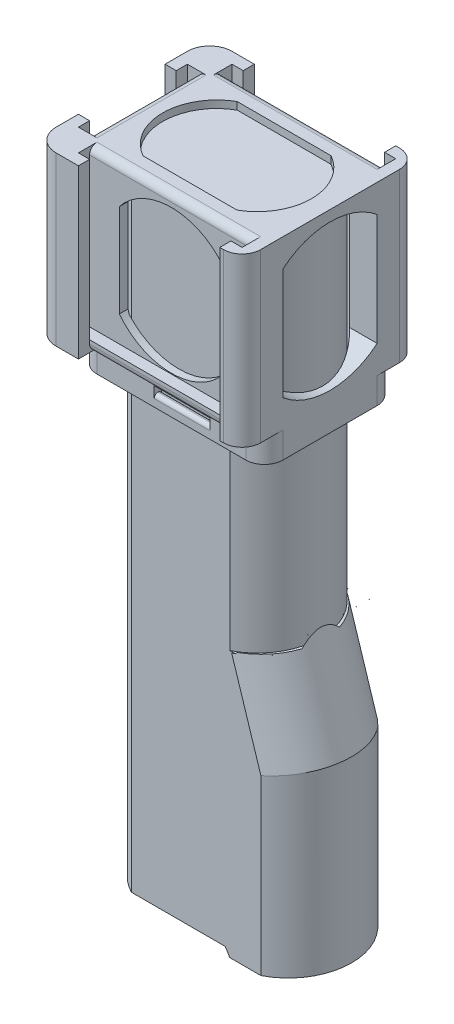
from build123d import *

# Parameters (mm, degrees)
BOSS_EXTRUDE1_DEPTH      = 30.3
CUT_EXTRUDE1_DEPTH       = 181.717957049
CUT_EXTRUDE7_DEPTH       = 27.29
CUT_EXTRUDE10_DEPTH      = 96
CUT_EXTRUDE11_DEPTH      = 48
SKETCH9_W                = 2
SKETCH9_H                = 7.4
BOSS_EXTRUDE2_DEPTH      = 1.5
FILLET8_R                = 1
CUT_EXTRUDE15_DEPTH      = 2.6
CUT_EXTRUDE15_DEPTH_BACK = 2.6
SKETCH10_W               = 29
SKETCH10_H               = 15.5
SKETCH11_W               = 3.45
SKETCH11_H               = 8
BOSS_EXTRUDE3_DEPTH      = 1.3
FILLET9_R                = 7
CUT_EXTRUDE18_DEPTH      = 2.5
CUT_EXTRUDE23_START      = -2.5
CUT_EXTRUDE23_DEPTH      = 2.5
SKETCH18_W               = 4.5
SKETCH18_H               = 15
SKETCH18_W_2             = 3.45
SKETCH18_H_2             = 8
CUT_EXTRUDE24_DEPTH      = 1
THICKEN1_DEPTH           = 172.5
THICKEN1_START           = 71.5
THICKEN1_2_DEPTH         = 101
THICKEN1_START_2         = 170.5
THICKEN1_3_DEPTH         = 2
THICKEN1_4_DEPTH         = 71.5
THICKEN1_START_3         = 74
THICKEN1_5_DEPTH         = 96.5
THICKEN1_START_4         = -3
THICKEN1_6_DEPTH         = 37
CUT_EXTRUDE25_DEPTH      = 185.724309905
CUT_EXTRUDE25_DEPTH_BACK = 2
CUT_EXTRUDE26_START      = -35.3
SKETCH20_W               = 86.063057596
SKETCH20_H               = 120.5
CUT_EXTRUDE26_DEPTH      = 35.3
BOSS_EXTRUDE5_START      = -52
BOSS_EXTRUDE5_DEPTH      = 52
BOSS_EXTRUDE6_DEPTH      = 45
FILLET12_R               = 5
SKETCH23_W               = 15
SKETCH23_H               = 2
CUT_EXTRUDE27_DEPTH      = 186.210231899
FILLET16_R               = 1
SKETCH24_W               = 44
SKETCH24_H               = 3
SKETCH24_W_2             = 3
SKETCH24_H_2             = 29.3
BOSS_EXTRUDE7_DEPTH      = 3
SKETCH25_W               = 25.3
SKETCH25_H               = 30
CUT_EXTRUDE28_DEPTH      = 50
SKETCH26_W               = 28
SKETCH26_H               = 25
CUT_EXTRUDE29_DEPTH      = 50
FILLET17_R               = 2
FILLET18_R               = 5


with BuildPart() as part:
    # Sketch1 → Boss-Extrude1 (new body)
    with BuildSketch(Plane.XY):
        Polygon((34.45, 2), (35.7, 0), (53.3, 0), (53.3, 48), (45, 74), (45, 170), (0, 170), (0, 2), align=None)
    extrude(amount=BOSS_EXTRUDE1_DEPTH)

    # Sketch2 → Cut-Extrude1 (cut, through all)
    with BuildSketch(Plane(origin=(0, 170, 0), x_dir=(1, 0, 0), z_dir=(0, 1, 0))):
        with BuildLine():
            Line((0, -30.3), (9.25, -30.3))
            ThreePointArc((9.25, -30.3), (2.495291793, -24.025316905), (0, -15.150000022))
            Line((0, -15.150000022), (0, -30.3))
        make_face()
        with BuildLine():
            ThreePointArc((0, -15.150000022), (2.495291781, -6.274683113), (9.25, 0))
            Line((9.25, 0), (0, 0))
            Line((0, 0), (0, -15.150000022))
        make_face()
    extrude(amount=-CUT_EXTRUDE1_DEPTH, mode=Mode.SUBTRACT)

    # Sketch7 → Cut-Extrude7 (cut)
    with BuildSketch(Plane(origin=(-8.97657775, 28.11940018, 0), x_dir=(0, 0, -1), z_dir=(0.30411092373144827, -0.9526366285563479, 0))):
        with BuildLine():
            Line((-15.15, 65.372856641), (-30.3, 65.372856641))
            Line((-30.3, 65.372856641), (-30.3, 56.120928382))
            ThreePointArc((-30.3, 56.120928382), (-24.02581935, 62.876979624), (-15.15, 65.372856641))
        make_face()
        with BuildLine():
            Line((0, 65.372856641), (-15.15, 65.372856641))
            ThreePointArc((-15.15, 65.372856641), (-6.27418065, 62.876979624), (0, 56.120928382))
            Line((0, 56.120928382), (0, 65.372856641))
        make_face()
    extrude(amount=-CUT_EXTRUDE7_DEPTH, mode=Mode.SUBTRACT)

    # Sketch6 → Cut-Extrude10 (cut)
    with BuildSketch(Plane(origin=(0, 170, 0), x_dir=(1, 0, 0), z_dir=(0, 1, 0))):
        with BuildLine():
            Line((45, -15.15), (45, 0))
            Line((45, 0), (35.74807174, 0))
            ThreePointArc((35.74807174, 0), (42.504122982, -6.27418065), (45, -15.15))
        make_face()
        with BuildLine():
            Line((45, -30.3), (45, -15.15))
            ThreePointArc((45, -15.15), (42.504122982, -24.02581935), (35.74807174, -30.3))
            Line((35.74807174, -30.3), (45, -30.3))
        make_face()
    extrude(amount=-CUT_EXTRUDE10_DEPTH, mode=Mode.SUBTRACT)

    # Sketch4 → Cut-Extrude11 (cut)
    with BuildSketch(Plane.XZ):
        with BuildLine():
            Line((53.3, 15.15), (53.3, 30.3))
            Line((53.3, 30.3), (44.04807174, 30.3))
            ThreePointArc((44.04807174, 30.3), (50.804122982, 24.02581935), (53.3, 15.15))
        make_face()
        with BuildLine():
            Line((53.3, 0), (53.3, 15.15))
            ThreePointArc((53.3, 15.15), (50.804122982, 6.27418065), (44.04807174, 0))
            Line((44.04807174, 0), (53.3, 0))
        make_face()
    extrude(amount=-CUT_EXTRUDE11_DEPTH, mode=Mode.SUBTRACT)

    # Sketch9 → Boss-Extrude2 (add)
    with BuildSketch(Plane.XZ.offset(-2)):
        with Locations((3, 15.15)):
            Rectangle(SKETCH9_W, SKETCH9_H)
    extrude(amount=BOSS_EXTRUDE2_DEPTH)

    # Fillet8
    fillet8_edges = [part.edges().sort_by_distance(p)[0] for p in [
        (4, 1.25, 11.45),
        (2, 1.25, 11.45),
        (4, 1.25, 18.85),
        (2, 1.25, 18.85),
    ]]
    fillet(fillet8_edges, radius=FILLET8_R - 0.0001)  # a hair under: the kernel refuses the full size

    # Sketch10 → Cut-Extrude15 (cut, two sides: drawn at the far end of the back side and taken through both)
    with BuildSketch(Plane.XZ.offset(-2).offset(-CUT_EXTRUDE15_DEPTH_BACK)):
        with Locations((21, 15.15)):
            Rectangle(SKETCH10_W, SKETCH10_H)
    extrude(amount=CUT_EXTRUDE15_DEPTH + CUT_EXTRUDE15_DEPTH_BACK, mode=Mode.SUBTRACT)

    # Sketch11 → Boss-Extrude3 (add)
    with BuildSketch(Plane.XZ):
        with Locations((43.575, 15.15)):
            Rectangle(SKETCH11_W, SKETCH11_H)
    extrude(amount=BOSS_EXTRUDE3_DEPTH)

    # Fillet9
    # the kernel refuses this fillet: 7 mm, written as the material it takes off along each edge
    with BuildSketch(Plane(origin=(55.458124827, -1.3, 11.15), x_dir=(0, 1, 0), z_dir=(-1, 0, 0)), Plane(origin=(31.691875173, -1.3, 19.15), x_dir=(0, 1, 0), z_dir=(1, 0, 0))) as fillet9_piece_1:
        with BuildLine():
            CenterArc((7, -4.063249931), FILLET9_R, 144.516796045, 35.483203955)
            Line((0, -4.063249931), (-0.14, -4.063249931))
            Line((-0.14, -4.063249931), (-0.14, 0))
            Line((-0.14, 0), (0, 0.14))
            ThreePointArc((0, 0.14), (0.65, 0.14), (1.186, 0.081264999))
            Line((1.186, 0.081264999), (1.3, 0))
        make_face()
    extrude(amount=23.766249654, mode=Mode.SUBTRACT)

    # Sketch13 → Cut-Extrude18 (cut)
    with BuildSketch(Plane(origin=(0, 74, 0), x_dir=(1, 0, 0), z_dir=(0, 1, 0))):
        with BuildLine():
            Line((35.74807174, -30.3), (45, -30.3))
            Line((45, -30.3), (45, -15.15))
            ThreePointArc((45, -15.15), (42.504122982, -24.02581935), (35.74807174, -30.3))
        make_face()
    extrude(amount=-CUT_EXTRUDE18_DEPTH, mode=Mode.SUBTRACT)

    # Cut-Extrude23: read off the stored shape, not the designer's step
    # Cut-Extrude23 outline → Cut-Extrude23 (cut)
    with BuildSketch(Plane(origin=(0, 74, 0), x_dir=(1, 0, 0), z_dir=(0, 1, 0)).offset(CUT_EXTRUDE23_START)):
        with BuildLine():
            ThreePointArc((44.999624541, -15.036915931), (44.999829684, -15.061319249), (45, -15.085722835))
            Line((45, -15.085722835), (45, 0))
            Line((45, 0), (35.74807174, 0))
            ThreePointArc((35.74807174, 0), (42.474573722, -6.225973939), (44.999624541, -15.036915931))
        make_face()
    extrude(amount=CUT_EXTRUDE23_DEPTH, mode=Mode.SUBTRACT)

    # Sketch18 → Cut-Extrude24 (cut)
    with BuildSketch(Plane.XZ):
        with Locations((43.575, 15.15)):
            Rectangle(SKETCH18_W, SKETCH18_H)
        with Locations((43.575, 15.15)):
            Rectangle(SKETCH18_W_2, SKETCH18_H_2, mode=Mode.SUBTRACT)
    extrude(amount=-CUT_EXTRUDE24_DEPTH, mode=Mode.SUBTRACT)


with BuildPart() as body_2:
    # Thicken1: read off the stored shape, not the designer's step
    # Thicken1 outline → Thicken1 (new body)
    with BuildSketch(Plane(origin=(0, 0, 0), x_dir=(1, 0, 0), z_dir=(0, 1, 0))):
        with BuildLine():
            ThreePointArc((36.330526299, -32.8), (38.041656858, -31.882681439), (39.653252972, -30.8))
            Line((39.653252972, -30.8), (9.130023259, -30.8))
            ThreePointArc((9.130023259, -30.8), (-0.5, -15.15), (9.130023259, 0.5))
            Line((9.130023259, 0.5), (39.653252972, 0.5))
            ThreePointArc((39.653252972, 0.5), (38.041656858, 1.582681439), (36.330526299, 2.5))
            Line((36.330526299, 2.5), (8.667307952, 2.5))
            ThreePointArc((8.667307952, 2.5), (-2.5, -15.15), (8.667307952, -32.8))
            Line((8.667307952, -32.8), (36.330526299, -32.8))
        make_face()
    extrude(amount=THICKEN1_DEPTH)

    # Thicken1 2 outline → Thicken1 2 (add)
    with BuildSketch(Plane(origin=(0, 0, 0), x_dir=(1, 0, 0), z_dir=(0, 1, 0)).offset(THICKEN1_START)):
        with BuildLine():
            ThreePointArc((39.653252972, -30.8), (45.428448249, -23.903484148), (47.5, -15.15))
            Line((47.5, -15.15), (45.5, -15.15))
            ThreePointArc((45.5, -15.15), (42.899046111, -24.338279611), (35.867999747, -30.8))
            Line((35.867999747, -30.8), (39.653252972, -30.8))
        make_face()
        with BuildLine():
            Line((45.499613517, -15.033595788), (47.499569423, -15.020315216))
            ThreePointArc((47.499569423, -15.020315216), (45.399289044, -6.338599235), (39.653252972, 0.5))
            Line((39.653252972, 0.5), (35.867999747, 0.5))
            ThreePointArc((35.867999747, 0.5), (42.868457256, -5.912204192), (45.499613517, -15.033595788))
        make_face()
    extrude(amount=THICKEN1_2_DEPTH)

    # Thicken1 3 outline → Thicken1 3 (add)
    with BuildSketch(Plane(origin=(0, 0, 0), x_dir=(1, 0, 0), z_dir=(0, 1, 0)).offset(THICKEN1_START_2)):
        with BuildLine():
            Line((45.5, -15.15), (47.5, -15.15))
            ThreePointArc((47.5, -15.15), (47.499892356, -15.085157251), (47.499569423, -15.020315216))
            Line((47.499569423, -15.020315216), (45.499613517, -15.033595788))
            ThreePointArc((45.499613517, -15.033595788), (42.868457256, -5.912204192), (35.867999747, 0.5))
            Line((35.867999747, 0.5), (9.130023259, 0.5))
            ThreePointArc((9.130023259, 0.5), (-0.5, -15.15), (9.130023259, -30.8))
            Line((9.130023259, -30.8), (35.867999747, -30.8))
            ThreePointArc((35.867999747, -30.8), (42.899046111, -24.338279611), (45.5, -15.15))
        make_face()
    extrude(amount=THICKEN1_3_DEPTH)

    # Thicken1 4 outline → Thicken1 4 (add)
    with BuildSketch(Plane(origin=(0, 0, 0), x_dir=(1, 0, 0), z_dir=(0, 1, 0))):
        with BuildLine():
            Line((44.04807174, -30.8), (39.653252972, -30.8))
            ThreePointArc((39.653252972, -30.8), (38.041656858, -31.882681439), (36.330526299, -32.8))
            Line((36.330526299, -32.8), (44.04807174, -32.8))
            Line((44.04807174, -32.8), (44.04807174, -30.8))
        make_face()
        with BuildLine():
            ThreePointArc((36.330526299, 2.5), (38.041656858, 1.582681439), (39.653252972, 0.5))
            Line((39.653252972, 0.5), (44.04807174, 0.5))
            Line((44.04807174, 0.5), (44.04807174, 2.5))
            Line((44.04807174, 2.5), (36.330526299, 2.5))
        make_face()
    extrude(amount=THICKEN1_4_DEPTH)

    # Thicken1 5 outline → Thicken1 5 (add)
    with BuildSketch(Plane(origin=(0, 0, 0), x_dir=(1, 0, 0), z_dir=(0, 1, 0)).offset(THICKEN1_START_3)):
        with BuildLine():
            Line((45.5, -15.15), (47.5, -15.15))
            ThreePointArc((47.5, -15.15), (47.499892356, -15.085157251), (47.499569423, -15.020315216))
            Line((47.499569423, -15.020315216), (45.499613517, -15.033595788))
            ThreePointArc((45.499613517, -15.033595788), (45.499903379, -15.091797573), (45.5, -15.15))
        make_face()
    extrude(amount=THICKEN1_5_DEPTH)

    # Thicken1 6 outline → Thicken1 6 (cut)
    with BuildSketch(Plane.XY.offset(THICKEN1_START_4)):
        Polygon((44.04807174, 71.5), (37.177464286, 71.5), (36.187087147, 71.183841144), (44.04807174, 46.559070127), align=None)
        Polygon((-4, 0), (35.7, 0), (34.45, 2), (-4, 2), align=None)
    extrude(amount=THICKEN1_6_DEPTH, mode=Mode.SUBTRACT)

    # Sketch19 → Cut-Extrude25 (cut, two sides: drawn at the far end of the back side and taken through both)
    with BuildSketch(Plane(origin=(0, 172.5, 0), x_dir=(1, 0, 0), z_dir=(0, 1, 0)).offset(-CUT_EXTRUDE25_DEPTH_BACK)):
        with BuildLine():
            Line((9.880011526, -27.8), (35.118314487, -27.8))
            ThreePointArc((35.118314487, -27.8), (42.5, -15.15), (35.118314487, -2.5))
            Line((35.118314487, -2.5), (9.880011526, -2.5))
            ThreePointArc((9.880011526, -2.5), (2.5, -15.15), (9.880011526, -27.8))
        make_face()
    extrude(amount=CUT_EXTRUDE25_DEPTH + CUT_EXTRUDE25_DEPTH_BACK, mode=Mode.SUBTRACT)

    # Sketch20 → Cut-Extrude26 (cut)
    with BuildSketch(Plane(origin=(0, 0, -2.5), x_dir=(-1, 0, 0), z_dir=(0, 0, -1)).offset(CUT_EXTRUDE26_START)):
        with Locations((-40.531528798, 60.25)):
            Rectangle(SKETCH20_W, SKETCH20_H)
    extrude(amount=CUT_EXTRUDE26_DEPTH, mode=Mode.SUBTRACT)

    # Sketch21 → Boss-Extrude5 (add)
    with BuildSketch(Plane(origin=(0, 172.5, 0), x_dir=(1, 0, 0), z_dir=(0, 1, 0)).offset(BOSS_EXTRUDE5_START)):
        with BuildLine():
            Line((8.667307952, 2.5), (-2.5, 2.5))
            Line((-2.5, 2.5), (-2.5, -15.149999996))
            ThreePointArc((-2.5, -15.149999996), (0.526276233, -4.706924938), (8.667307952, 2.5))
        make_face()
        with BuildLine():
            ThreePointArc((8.667307952, -32.8), (0.52627623, -25.593075059), (-2.5, -15.149999996))
            Line((-2.5, -15.149999996), (-2.5, -32.8))
            Line((-2.5, -32.8), (8.667307952, -32.8))
        make_face()
        with BuildLine():
            Line((47.5, 2.5), (36.330526299, 2.5))
            ThreePointArc((36.330526299, 2.5), (44.473059998, -4.706345913), (47.5, -15.15))
            Line((47.5, -15.15), (47.5, 2.5))
        make_face()
        with BuildLine():
            Line((47.5, -32.8), (47.5, -15.15))
            ThreePointArc((47.5, -15.15), (44.473059998, -25.593654087), (36.330526299, -32.8))
            Line((36.330526299, -32.8), (47.5, -32.8))
        make_face()
    extrude(amount=BOSS_EXTRUDE5_DEPTH)

    # Sketch22 → Boss-Extrude6 (add)
    with BuildSketch(Plane(origin=(0, 172.5, 0), x_dir=(1, 0, 0), z_dir=(0, 1, 0))):
        Polygon((0.5, -32.8), (-2.5, -32.8), (-2.5, -38.8), (3.5, -38.8), (3.5, -35.8), (0.5, -35.8), align=None)
        Polygon((47.5, -32.8), (44.5, -32.8), (44.5, -35.8), (41.5, -35.8), (41.5, -38.8), (47.5, -38.8), align=None)
        Polygon((-8.5, -32.8), (-2.5, -32.8), (-2.5, -29.8), (-5.5, -29.8), (-5.5, -26.8), (-8.5, -26.8), align=None)
        Polygon((-5.5, -0.5), (-2.5, -0.5), (-2.5, 2.5), (-8.5, 2.5), (-8.5, -3.5), (-5.5, -3.5), align=None)
        Polygon((-2.5, 8.5), (-2.5, 2.5), (0.5, 2.5), (0.5, 5.5), (3.5, 5.5), (3.5, 8.5), align=None)
        Polygon((44.5, 5.5), (44.5, 2.5), (47.5, 2.5), (47.5, 8.5), (41.5, 8.5), (41.5, 5.5), align=None)
        with BuildLine():
            Line((-2.5, -32.8), (-8.5, -32.8))
            ThreePointArc((-8.5, -32.8), (-6.742640687, -37.042640687), (-2.5, -38.8))
            Line((-2.5, -38.8), (-2.5, -32.8))
        make_face()
        with BuildLine():
            ThreePointArc((-8.5, 2.5), (-6.742640687, 6.742640687), (-2.5, 8.5))
            Line((-2.5, 8.5), (-2.5, 2.5))
            Line((-2.5, 2.5), (-8.5, 2.5))
        make_face()
    extrude(amount=-BOSS_EXTRUDE6_DEPTH)

    # Fillet12
    fillet12_edges = [body_2.edges().sort_by_distance(p)[0] for p in [
        (47.5, 150, 38.8),
        (47.5, 150, -8.5),
    ]]
    fillet(fillet12_edges, radius=FILLET12_R)

    # Sketch23 → Cut-Extrude27 (cut, through all)
    with BuildSketch(Plane.XY.offset(32.8)):
        with Locations((25.38, 124.5)):
            Rectangle(SKETCH23_W, SKETCH23_H)
    extrude(amount=-CUT_EXTRUDE27_DEPTH, mode=Mode.SUBTRACT)

    # Fillet16
    fillet16_edges = [body_2.edges().sort_by_distance(p)[0] for p in [
        (25.38, 123.5, -0.5),
        (25.38, 123.5, -2.5),
        (25.38, 123.5, 30.8),
        (25.38, 123.5, 32.8),
    ]]
    fillet(fillet16_edges, radius=FILLET16_R - 0.0001)  # a hair under: the kernel refuses the full size

    # Sketch24 → Boss-Extrude7 (add)
    with BuildSketch(Plane.XZ.offset(-127.5)):
        with Locations((22.5, 34.3)):
            Rectangle(SKETCH24_W, SKETCH24_H)
        with Locations((-4, 15.15)):
            Rectangle(SKETCH24_W_2, SKETCH24_H_2)
        with Locations((22.5, -4)):
            Rectangle(SKETCH24_W, SKETCH24_H)
    extrude(amount=-BOSS_EXTRUDE7_DEPTH)

    # Sketch25 → Cut-Extrude28 (cut)
    with BuildSketch(Plane(origin=(47.5, 0, 0), x_dir=(0, 0, -1), z_dir=(1, 0, 0))):
        with Locations((-15.15, 150)):
            Rectangle(SKETCH25_W, SKETCH25_H)
        with BuildLine():
            ThreePointArc((-27.8, 165), (-15.15, 169.614933189), (-2.5, 165))
            Line((-2.5, 165), (-27.8, 165))
        make_face()
        with BuildLine():
            Line((-27.8, 135), (-2.5, 135))
            ThreePointArc((-2.5, 135), (-15.15, 130.385066811), (-27.8, 135))
        make_face()
    extrude(amount=-CUT_EXTRUDE28_DEPTH, mode=Mode.SUBTRACT)

    # Sketch26 → Cut-Extrude29 (cut)
    with BuildSketch(Plane.XY.offset(32.8)):
        with Locations((22.5, 150)):
            Rectangle(SKETCH26_W, SKETCH26_H)
        with BuildLine():
            ThreePointArc((8.5, 162.5), (22.5, 169.311701585), (36.5, 162.5))
            Line((36.5, 162.5), (8.5, 162.5))
        make_face()
        with BuildLine():
            Line((8.5, 137.5), (36.5, 137.5))
            ThreePointArc((36.5, 137.5), (22.5, 130.688298415), (8.5, 137.5))
        make_face()
    extrude(amount=-CUT_EXTRUDE29_DEPTH, mode=Mode.SUBTRACT)

    # Fillet17
    fillet17_edges = [body_2.edges().sort_by_distance(p)[0] for p in [
        (22.5, 172.5, 32.8),
        (22.5, 172.5, -2.5),
        (-2.5, 172.5, 15.15),
        (22.5, 127.5, 35.8),
        (-5.5, 127.5, 15.15),
        (22.5, 127.5, -5.5),
    ]]
    fillet(fillet17_edges, radius=FILLET17_R)

    # Fillet18
    fillet18_edges = [body_2.edges().sort_by_distance(p)[0] for p in [
        (-2.5, 124, -2.5),
        (-2.5, 124, 32.8),
        (47.5, 124, -2.5),
        (47.5, 124, 32.8),
    ]]
    fillet(fillet18_edges, radius=FILLET18_R)


solid = Compound([part.part, body_2.part])
